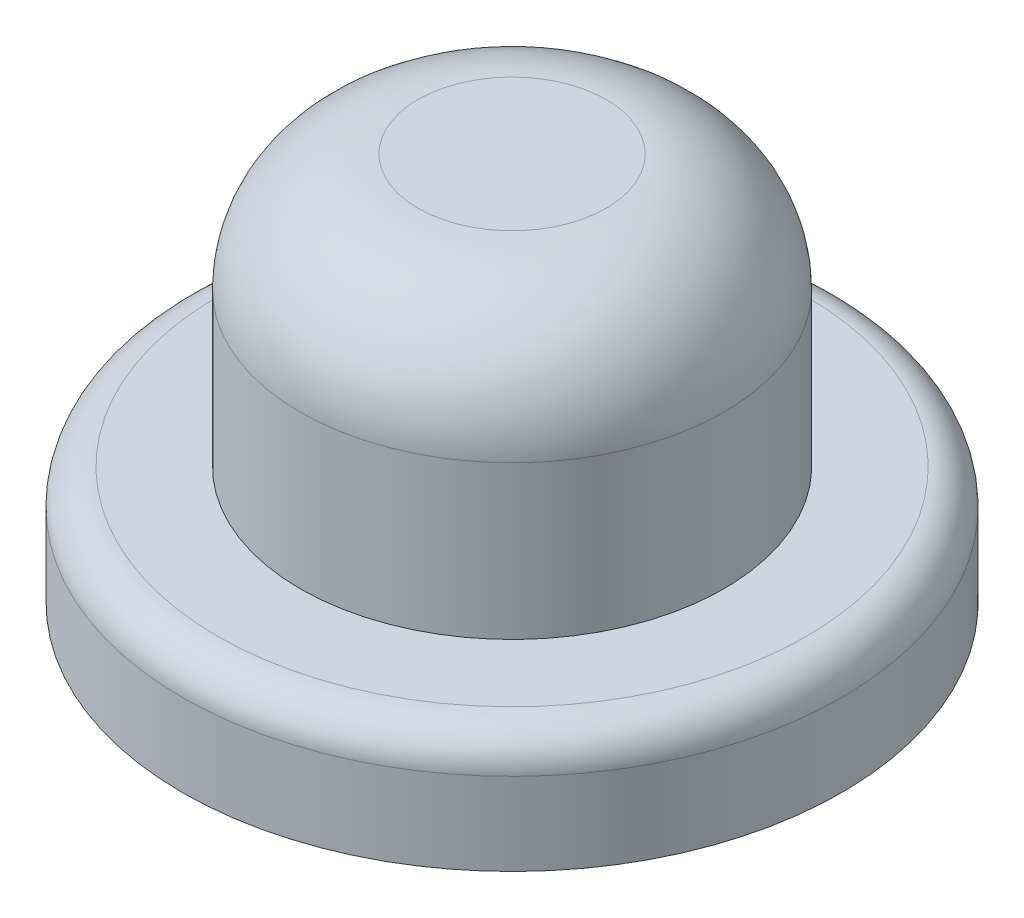
from build123d import *

# Parameters (mm, degrees)
SKETCH_1_R      = 2.8
EXTRUDE_2_DEPTH = 1
SKETCH_2_R      = 1.8
EXTRUDE_3_DEPTH = 2.3
FILLET_1_R      = 1
FILLET_2_R      = 0.3


with BuildPart() as part:
    # 草图1 → 凸台-拉伸2 (new body)
    with BuildSketch(Plane(origin=(0, 0, 0), x_dir=(1, 0, 0), z_dir=(0, 1, 0))):
        Circle(SKETCH_1_R)
    extrude(amount=EXTRUDE_2_DEPTH)

    # 草图2 → 凸台-拉伸3 (add)
    with BuildSketch(Plane(origin=(0, 1, 0), x_dir=(1, 0, 0), z_dir=(0, 1, 0))):
        Circle(SKETCH_2_R)
    extrude(amount=EXTRUDE_3_DEPTH)

    # 圆角1
    fillet_1_edges = [part.edges().sort_by_distance(p)[0] for p in [
        (-1.8, 3.3, 0),
    ]]
    fillet(fillet_1_edges, radius=FILLET_1_R)

    # 圆角2
    fillet_2_edges = [part.edges().sort_by_distance(p)[0] for p in [
        (-2.8, 1, 0),
    ]]
    fillet(fillet_2_edges, radius=FILLET_2_R)


solid = part.part
